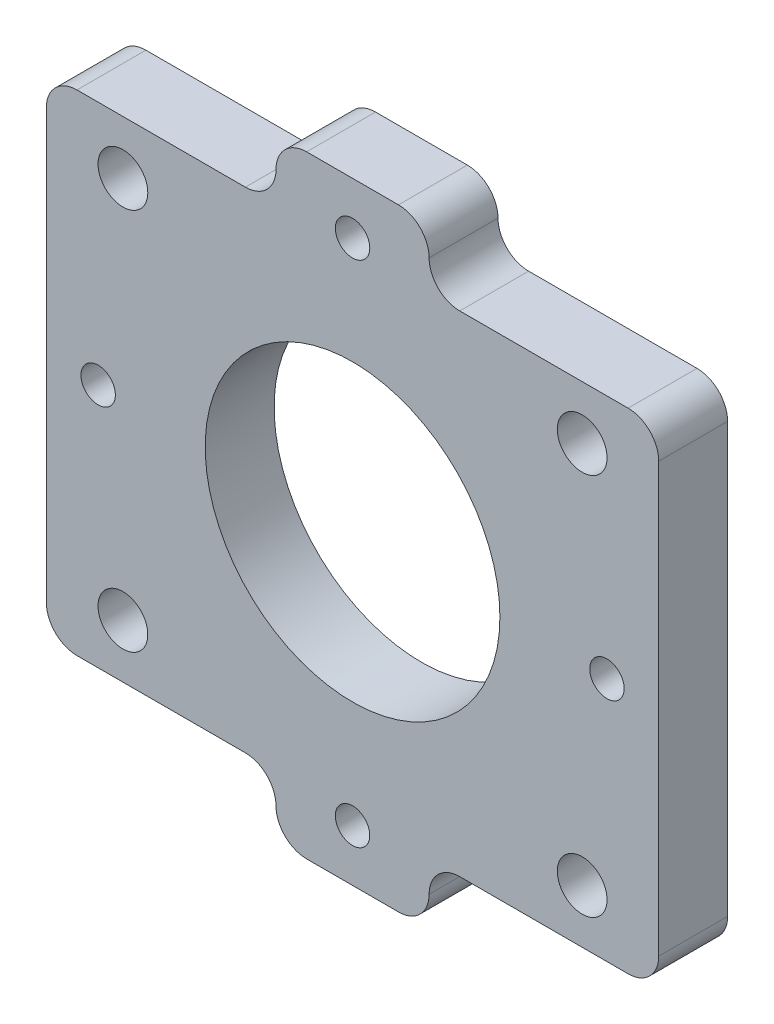
from build123d import *

# Parameters (mm, degrees)
ESQUISSE1_W                  = 80
ESQUISSE1_H                  = 80
BOSS_EXTRU_1_DEPTH           = 9
ESQUISSE2_R                  = 19.25
ESQUISSE2_R_2                = 2.25
ESQUISSE2_R_3                = 3.25
ENL_V_MAT_EXTRU_1_DEPTH      = 114.494493258
ENL_V_MAT_EXTRU_2_DEPTH      = 114.494493258
ENL_V_MAT_EXTRU_2_DEPTH_BACK = 114.494493258
ESQUISSE3_W                  = 30
ESQUISSE3_H                  = 8
CONG_1_R                     = 4


with BuildPart() as part:
    # Esquisse1 → Boss.-Extru.1 (new body)
    with BuildSketch(Plane.XY):
        with Locations((40, 40)):
            Rectangle(ESQUISSE1_W, ESQUISSE1_H)
    extrude(amount=BOSS_EXTRU_1_DEPTH)

    # Esquisse2 → Enlèv. mat.-Extru.1 (cut, through all)
    with BuildSketch(Plane.XY.offset(9)):
        with Locations((40, 40)):
            Circle(ESQUISSE2_R)
        with Locations((73.234018716, 40)):
            Circle(ESQUISSE2_R_2)
        with Locations((40, 73.234018716)):
            Circle(ESQUISSE2_R_2)
        with Locations(Location((6.765981284, 40, 0), (0, 0, 180))):
            Circle(ESQUISSE2_R_2)
        with Locations(Location((40, 6.765981284, 0), (0, 0, 180))):
            Circle(ESQUISSE2_R_2)
        with Locations((10, 65)):
            Circle(ESQUISSE2_R_3)
        with Locations(Location((70, 65, 0), (0, 0, 180))):
            Circle(ESQUISSE2_R_3)
        with Locations((70, 15)):
            Circle(ESQUISSE2_R_3)
        with Locations(Location((10, 15, 0), (0, 0, 180))):
            Circle(ESQUISSE2_R_3)
    extrude(amount=-ENL_V_MAT_EXTRU_1_DEPTH, mode=Mode.SUBTRACT)

    # Esquisse3 → Enlèv. mat.-Extru.2 (cut, two sides: drawn at the far end of the back side and taken through both)
    with BuildSketch(Plane.XY.offset(9).offset(-ENL_V_MAT_EXTRU_2_DEPTH_BACK)):
        with Locations((15, 76)):
            Rectangle(ESQUISSE3_W, ESQUISSE3_H)
        with Locations((65, 76)):
            Rectangle(ESQUISSE3_W, ESQUISSE3_H)
        with Locations((15, 4)):
            Rectangle(ESQUISSE3_W, ESQUISSE3_H)
        with Locations((65, 4)):
            Rectangle(ESQUISSE3_W, ESQUISSE3_H)
    extrude(amount=ENL_V_MAT_EXTRU_2_DEPTH + ENL_V_MAT_EXTRU_2_DEPTH_BACK, mode=Mode.SUBTRACT)

    # Congé1
    cong_1_edges = [part.edges().sort_by_distance(p)[0] for p in [
        (30, 72, 4.5),
        (50, 72, 4.5),
        (50, 8, 4.5),
        (30, 8, 4.5),
        (0, 8, 4.5),
        (30, 0, 4.5),
        (50, 0, 4.5),
        (80, 8, 4.5),
        (80, 72, 4.5),
        (50, 80, 4.5),
        (30, 80, 4.5),
        (0, 72, 4.5),
    ]]
    fillet(cong_1_edges, radius=CONG_1_R - 0.0001)  # a hair under: the kernel refuses the full size


solid = part.part
